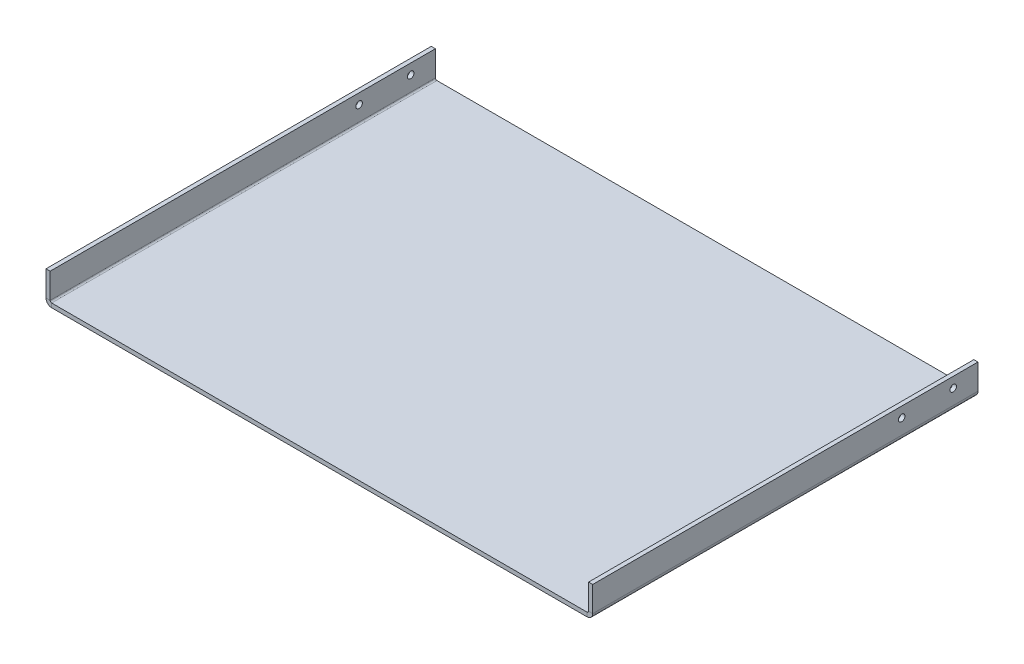
from build123d import *

# Parameters (mm, degrees)
SKETCH_1_W                         = 265
SKETCH_1_H                         = 186.75
SM_BASE_FLANGE_1_DEPTH             = 2
SM_EDGE_FLANGE_1_STRIP_W           = 9.4732
SM_EDGE_FLANGE_1_STRIP_H           = 2
SM_EDGE_FLANGE_1_STRIP_CUT_DEPTH   = 186.75
SM_EDGE_FLANGE_1_STRIP_2_W         = 9.4732
SM_EDGE_FLANGE_1_STRIP_2_H         = 2
SM_EDGE_FLANGE_1_STRIP_CUT_2_DEPTH = 186.75
SM_EDGE_FLANGE_1_DEPTH             = 186.75
SM_EDGE_FLANGE_1_BEND_DEPTH        = 186.75
SKETCH_12_R                        = 1.6
CUT_EXTRUDE_1_DEPTH                = 281


# Sheet-metal steps are written as plain solids
with BuildPart() as part:
    # Sketch 1 → Базовая кромка1 (new body)
    with BuildSketch(Plane(origin=(0, 0, 0), x_dir=(1, 0, 0), z_dir=(0, 1, 0))):
        with Locations((-90.995998399, -61.873281816)):
            Rectangle(SKETCH_1_W, SKETCH_1_H)
    extrude(amount=-SM_BASE_FLANGE_1_DEPTH)

    # Ребро-кромка1 strip (across the edge) → Ребро-кромка1 strip cut (cut)
    with BuildSketch(Plane(origin=(-223.495998399, 0, -31.501718184), x_dir=(1, 0, 0), z_dir=(0, 0, 1))):
        with Locations((-2, -1)):
            Rectangle(SM_EDGE_FLANGE_1_STRIP_W, SM_EDGE_FLANGE_1_STRIP_H)
    extrude(amount=SM_EDGE_FLANGE_1_STRIP_CUT_DEPTH, mode=Mode.SUBTRACT)

    # Ребро-кромка1 strip 2 (across the edge) → Ребро-кромка1 strip cut 2 (cut)
    with BuildSketch(Plane(origin=(41.504001601, 0, 155.248281816), x_dir=(-1, 0, 0), z_dir=(0, 0, -1))):
        with Locations((-2, -1)):
            Rectangle(SM_EDGE_FLANGE_1_STRIP_2_W, SM_EDGE_FLANGE_1_STRIP_2_H)
    extrude(amount=SM_EDGE_FLANGE_1_STRIP_CUT_2_DEPTH, mode=Mode.SUBTRACT)

    # Ребро-кромка1 section (across the edge) → Ребро-кромка1 (add)
    with BuildSketch(Plane(origin=(-223.495998399, 0, -31.501718184), x_dir=(1, 0, 0), z_dir=(0, 0, 1))):
        with BuildLine():
            Line((0, 0.7366), (0, 13))
            Line((0, 13), (2, 13))
            Line((2, 13), (2, 0.7366))
            ThreePointArc((2, 0.7366), (2.215745145, 0.215745145), (2.7366, 0))
            Line((2.7366, 0), (2.7366, -2))
            ThreePointArc((2.7366, -2), (0.801531583, -1.198468417), (0, 0.7366))
        make_face()
    extrude(amount=SM_EDGE_FLANGE_1_DEPTH)

    # Ребро-кромка1 section 2 (across the edge) → Ребро-кромка1 bend (add)
    with BuildSketch(Plane(origin=(41.504001601, 0, 155.248281816), x_dir=(-1, 0, 0), z_dir=(0, 0, -1))):
        with BuildLine():
            Line((0, 0.7366), (0, 13))
            Line((0, 13), (2, 13))
            Line((2, 13), (2, 0.7366))
            ThreePointArc((2, 0.7366), (2.215745145, 0.215745145), (2.7366, 0))
            Line((2.7366, 0), (2.7366, -2))
            ThreePointArc((2.7366, -2), (0.801531583, -1.198468417), (0, 0.7366))
        make_face()
    extrude(amount=SM_EDGE_FLANGE_1_BEND_DEPTH)

    # Эскиз12 → Вырез-Вытянуть1 (cut)
    with BuildSketch(Plane.ZY.offset(223.495998399)):
        with Locations(Location((-19.501718184, 8, 0), (0, 0, 270))):
            Circle(SKETCH_12_R)
        with Locations(Location((5.498281816, 8, 0), (0, 0, 270))):
            Circle(SKETCH_12_R)
    extrude(amount=-CUT_EXTRUDE_1_DEPTH, mode=Mode.SUBTRACT)


solid = part.part
